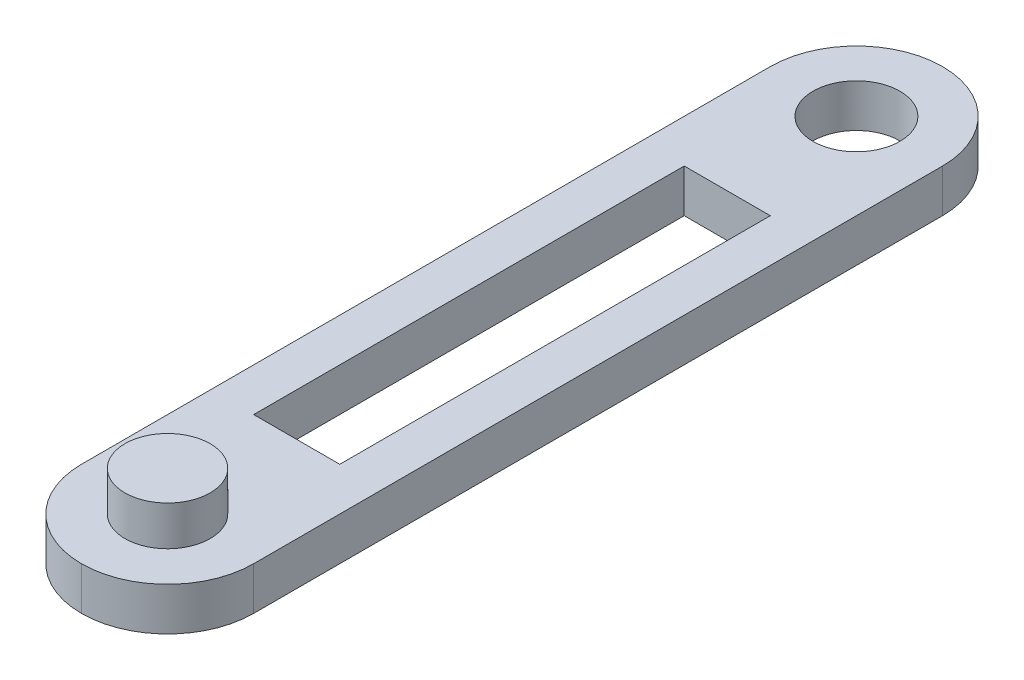
from build123d import *

# Parameters (mm, degrees)
SKETCH1_W           = 20
SKETCH1_H           = 100
BOSS_EXTRUDE1_DEPTH = 5
FILLET1_R           = 10
SKETCH2_R           = 4.95
BOSS_EXTRUDE2_DEPTH = 4.6
SKETCH2_4_R         = 5.05
CUT_EXTRUDE1_DEPTH  = 5
SKETCH4_W           = 10
SKETCH4_H           = 50
CUT_EXTRUDE2_DEPTH  = 5


with BuildPart() as part:
    # Sketch1 → Boss-Extrude1 (new body)
    with BuildSketch(Plane(origin=(0, 0, 0), x_dir=(1, 0, 0), z_dir=(0, 1, 0))):
        with Locations((-13.333333333, 18.974358974)):
            Rectangle(SKETCH1_W, SKETCH1_H)
    extrude(amount=BOSS_EXTRUDE1_DEPTH)

    # Fillet1
    fillet1_edges = [part.edges().sort_by_distance(p)[0] for p in [
        (-23.333333333, 2.5, -68.974358974),
        (-3.333333333, 2.5, -68.974358974),
        (-23.333333333, 2.5, 31.025641026),
        (-3.333333333, 2.5, 31.025641026),
    ]]
    fillet(fillet1_edges, radius=FILLET1_R - 0.0001)  # a hair under: the kernel refuses the full size

    # Sketch2 → Boss-Extrude2 (add)
    with BuildSketch(Plane(origin=(0, 5, 0), x_dir=(1, 0, 0), z_dir=(0, 1, 0))):
        with Locations(Location((-13.333333333, -21.025641026, 0), (0, 0, 90))):
            Circle(SKETCH2_R)
    extrude(amount=BOSS_EXTRUDE2_DEPTH)

    # Sketch2<4> → Cut-Extrude1 (cut)
    with BuildSketch(Plane(origin=(0, 5, 0), x_dir=(1, 0, 0), z_dir=(0, 1, 0))):
        with Locations(Location((-13.333333333, 58.974358974, 0), (0, 0, 270))):
            Circle(SKETCH2_4_R)
    extrude(amount=-CUT_EXTRUDE1_DEPTH, mode=Mode.SUBTRACT)

    # Sketch4 → Cut-Extrude2 (cut)
    with BuildSketch(Plane(origin=(0, 5, 0), x_dir=(1, 0, 0), z_dir=(0, 1, 0))):
        with Locations((-13.333333333, 18.974358974)):
            Rectangle(SKETCH4_W, SKETCH4_H)
    extrude(amount=-CUT_EXTRUDE2_DEPTH, mode=Mode.SUBTRACT)


solid = part.part
